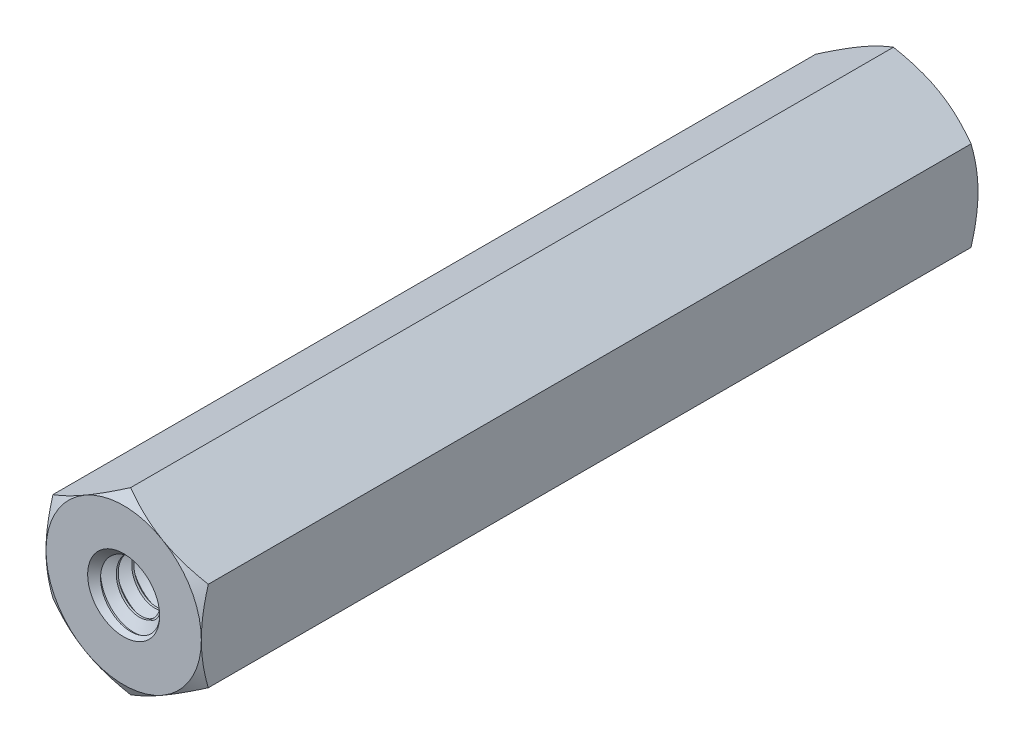
from build123d import *

# Parameters (mm, degrees)
EXTRUDE1_DEPTH          = 15.875
EXTRUDE1_DEPTH_BACK     = 15.875
SKETCH1_R               = 1.4224
SWEEP1_PITCH            = 0.635
EXTRUDE2_DEPTH          = 33.746311391
SKETCH8_OUTSIDE_W       = 132.012
SKETCH8_OUTSIDE_H       = 132.994
SKETCH8_OUTSIDE_R       = 3.175
EXTRUDE4_DEPTH          = 33.746311391
EXTRUDE4_DRAFT          = -60
MIRROR1_COPY_1_SKETCH_W = 132.012
MIRROR1_COPY_1_SKETCH_H = 132.994
MIRROR1_COPY_1_SKETCH_R = 3.175
MIRROR1_COPY_1_DEPTH    = 33.746311391
MIRROR1_COPY_1_DRAFT    = -60
SKETCH9_W               = 19.05
SKETCH9_H               = 1.4732


with BuildPart() as part:
    # Sketch1 → Extrude1 (new, two sides: drawn at the far end of the back side and taken through both)
    with BuildSketch(Plane.XY.offset(-EXTRUDE1_DEPTH_BACK)):
        Polygon((0, 3.666174209), (-3.175, 1.833087105), (-3.175, -1.833087105), (0, -3.666174209), (3.175, -1.833087105), (3.175, 1.833087105), align=None)
        Circle(SKETCH1_R, mode=Mode.SUBTRACT)
    extrude(amount=EXTRUDE1_DEPTH + EXTRUDE1_DEPTH_BACK)

    # Sweep1: the profile of Sketch12 profile screwed along a right-hand helix of 51 turns, 6 arcs to a turn; built about Z, then put on its axis
    sweep1_z = Axis((0, 0, 0), (0, 0, 1))
    sweep1_corners = [(1.4227, 0, -0.555798205), (1.4227, 0, 0.000173205), (1.009955401, 0, -0.238125), (1.009955401, 0, -0.3175)]
    with BuildLine(mode=Mode.PRIVATE) as sweep1_profile:
        Line(sweep1_corners[0], sweep1_corners[1])
        Line(sweep1_corners[1], sweep1_corners[2])
        Line(sweep1_corners[2], sweep1_corners[3])
        Line(sweep1_corners[3], sweep1_corners[0])
    sweep1_cap = Face(sweep1_profile.wire())
    sweep1_turn_angles = [0, 30, 60, 90, 120, 150, 180, 210, 240, 270, 300, 330, 360, 390, 420, 450, 480, 510, 540, 570, 600, 630, 660, 690, 720]
    sweep1_turn_weights = [1, 0.8660254037844387, 1, 0.8660254037844387, 1, 0.8660254037844387, 1, 0.8660254037844387, 1, 0.8660254037844387, 1, 0.8660254037844387, 1, 0.8660254037844387, 1, 0.8660254037844387, 1, 0.8660254037844387, 1, 0.8660254037844387, 1, 0.8660254037844387, 1, 0.8660254037844387, 1]
    sweep1_turn_rails = [Edge.make_bspline([Vector(p[0], p[1], 0).rotate(sweep1_z, sweep1_turn_angles[k]) / sweep1_turn_weights[k] + Vector(0, 0, p[2] + SWEEP1_PITCH * sweep1_turn_angles[k] / 360) for k in range(25)], [0, 0, 0, 1, 1, 2, 2, 3, 3, 4, 4, 5, 5, 6, 6, 7, 7, 8, 8, 9, 9, 10, 10, 11, 11, 12, 12, 12], 2, sweep1_turn_weights) for p in sweep1_corners]
    sweep1_turn_sides = [Face.make_surface_from_curves(sweep1_turn_rails[p[0]], sweep1_turn_rails[p[1]]) for p in [(0, 1), (1, 2), (2, 3), (3, 0)]]
    sweep1_last_angles = [18000, 18030, 18060, 18090, 18120, 18150, 18180, 18210, 18240, 18270, 18300, 18330, 18360]
    sweep1_last_weights = [1, 0.8660254037844387, 1, 0.8660254037844387, 1, 0.8660254037844387, 1, 0.8660254037844387, 1, 0.8660254037844387, 1, 0.8660254037864864, 1]
    sweep1_last_rails = [Edge.make_bspline([Vector(p[0], p[1], 0).rotate(sweep1_z, sweep1_last_angles[k]) / sweep1_last_weights[k] + Vector(0, 0, p[2] + SWEEP1_PITCH * sweep1_last_angles[k] / 360) for k in range(13)], [0, 0, 0, 1, 1, 2, 2, 3, 3, 4, 4, 5, 5, 6, 6, 6], 2, sweep1_last_weights) for p in sweep1_corners]
    sweep1_last_sides = [Face.make_surface_from_curves(sweep1_last_rails[p[0]], sweep1_last_rails[p[1]]) for p in [(0, 1), (1, 2), (2, 3), (3, 0)]]
    sweep1 = Plane(origin=(0, 0, -15.875), x_dir=(0, 1, 0), z_dir=(0, 0, 1)) * Solid(Shell([*[p.moved(Location((0, 0, 2 * SWEEP1_PITCH * i))) for i in range(25) for p in sweep1_turn_sides], *sweep1_last_sides, sweep1_cap, sweep1_cap.rotate(sweep1_z, 18360).moved(Location((0, 0, SWEEP1_PITCH * 18360 / 360)))]))
    add(sweep1)

    # Sketch6 → Extrude2 (cut, through all)
    with BuildSketch(Plane(origin=(0, 0, -15.875), x_dir=(-1, 0, 0), z_dir=(0, 0, -1))):
        Polygon((0, 3.666174209), (-3.175, 1.833087105), (-3.175, -1.833087105), (0, -3.666174209), (3.175, -1.833087105), (3.175, 1.833087105), align=None)
    extrude2 = extrude(amount=EXTRUDE2_DEPTH, mode=Mode.SUBTRACT)

    # Extrude3 cone 1 section (through the dimple's axis) → Extrude3 (revolve, cut)
    with BuildSketch(Plane(origin=(0, 0, -15.875), x_dir=(0, 1, 0), z_dir=(1, 0, 0))):
        Polygon((0, 0), (1.4732, 0), (0, 1.579813584), align=None)
    extrude3 = revolve(axis=Axis((0, 0, -15.875), (0, 0, 1)), mode=Mode.SUBTRACT)


with BuildPart() as extrude4_tool:
    # Sketch8 outside → Extrude4 (with draft: the straight prism first)
    with BuildSketch(Plane(origin=(0, 0, -15.875), x_dir=(-1, 0, 0), z_dir=(0, 0, -1))):
        Rectangle(SKETCH8_OUTSIDE_W, SKETCH8_OUTSIDE_H)
        Circle(SKETCH8_OUTSIDE_R, mode=Mode.SUBTRACT)
    extrude(amount=-EXTRUDE4_DEPTH)
    # Extrude4: the draft: its side faces are tilted about the plane it starts from
    extrude4_sides = [extrude4_tool.faces().sort_by_distance(p)[0] for p in [
        (0, -66.497, 0.998155695),
        (-66.006, 0, 0.998155695),
        (0, 66.497, 0.998155695),
        (66.006, 0, 0.998155695),
        (3.175, 0, 0.998155695),
    ]]
    draft(extrude4_sides, Plane(origin=(0, 0, -15.875), x_dir=(-1, 0, 0), z_dir=(0, 0, -1)), EXTRUDE4_DRAFT)


with BuildPart() as part_1:
    add(part.part)

    # Extrude4: cut by extrude4_tool
    add(extrude4_tool.part, mode=Mode.SUBTRACT)

    # Mirror1: Extrude2, Extrude3 across plane
    add(extrude2.mirror(Plane.XY), mode=Mode.SUBTRACT)
    add(extrude3.mirror(Plane.XY), mode=Mode.SUBTRACT)


with BuildPart() as mirror1_copy_1_tool:
    # Mirror1 copy 1 sketch → Mirror1 copy 1 (with draft: the straight prism first)
    with BuildSketch(Plane(origin=(0, 0, 15.875), x_dir=(-1, 0, 0), z_dir=(0, 0, 1))):
        Rectangle(MIRROR1_COPY_1_SKETCH_W, MIRROR1_COPY_1_SKETCH_H)
        Circle(MIRROR1_COPY_1_SKETCH_R, mode=Mode.SUBTRACT)
    extrude(amount=-MIRROR1_COPY_1_DEPTH)
    # Mirror1 copy 1: the draft: its side faces are tilted about the plane it starts from
    mirror1_copy_1_sides = [mirror1_copy_1_tool.faces().sort_by_distance(p)[0] for p in [
        (0, -66.497, -0.998155695),
        (-66.006, 0, -0.998155695),
        (0, 66.497, -0.998155695),
        (66.006, 0, -0.998155695),
        (3.175, 0, -0.998155695),
    ]]
    draft(mirror1_copy_1_sides, Plane(origin=(0, 0, 15.875), x_dir=(-1, 0, 0), z_dir=(0, 0, 1)), MIRROR1_COPY_1_DRAFT)


with BuildPart() as part_2:
    add(part_1.part)

    # Mirror1 copy 1: cut by mirror1_copy_1_tool
    add(mirror1_copy_1_tool.part, mode=Mode.SUBTRACT)

    # Sketch9 → Revolve 2 (revolve)
    with BuildSketch(Plane(origin=(0, 0, 0), x_dir=(0, 0, -1), z_dir=(1, 0, 0)), mode=Mode.PRIVATE) as revolve_2_sk:
        with Locations((0, 0.7366)):
            Rectangle(SKETCH9_W, SKETCH9_H)
    revolve(revolve_2_sk.sketch.rotate(Axis((0, 0, 15.875), (0, 0, -1)), 270), axis=Axis((0, 0, 15.875), (0, 0, -1)))


solid = part_2.part
